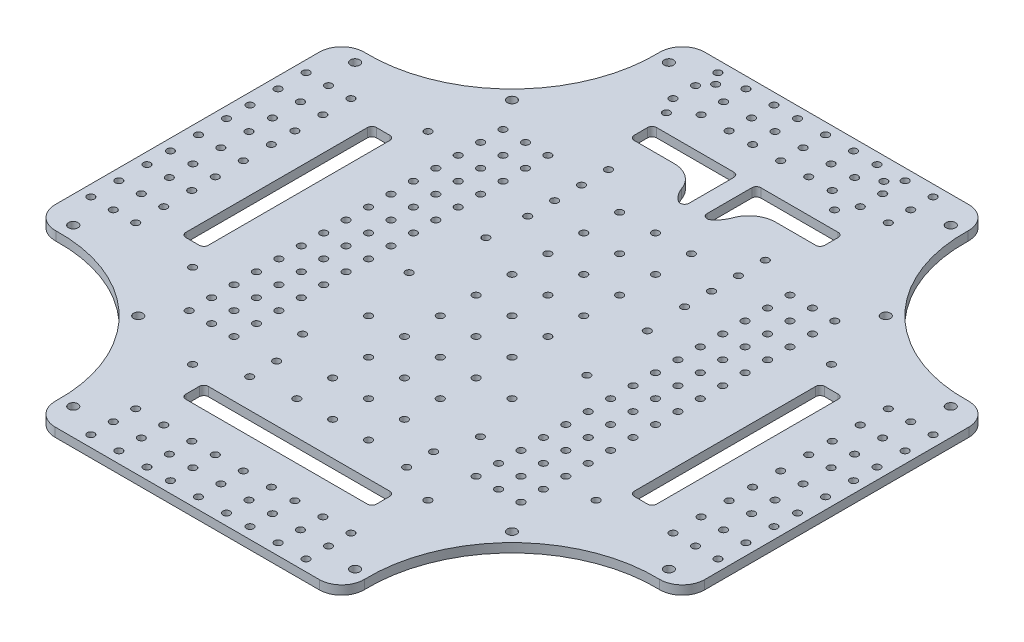
from build123d import *

# Parameters (mm, degrees)
SKETCH_1_R               = 2.075
SKETCH_1_R_2             = 1.6
EXTRUDE_1_DEPTH          = 2
FILLET_1_R               = 10
SKETCH_2_R               = 1.6
CUT_EXTRUDE_1_DEPTH      = 205.909000639
SKETCH_3_R               = 1.6
CUT_EXTRUDE_2_DEPTH      = 205.909000639
SKETCH_4_R               = 1.6
CUT_EXTRUDE_3_DEPTH      = 205.909000639
CUT_EXTRUDE_4_DEPTH      = 205.909000639
FILLET_2_R               = 2
CUT_EXTRUDE_5_DEPTH      = 205.909000639
CUT_EXTRUDE_5_DEPTH_BACK = 205.909000639
SKETCH_7_R               = 1.6


with BuildPart() as part:
    # 草图1 → 凸台-拉伸1 (new, symmetric)
    with BuildSketch(Plane(origin=(0, 0, 0), x_dir=(1, 0, 0), z_dir=(0, 1, 0))):
        with BuildLine():
            ThreePointArc((-68.864934582, 132.864934582), (-92.072778473, 83.549622558), (-144.864934582, 70))
            Line((-144.864934582, 70), (-144.864934582, -70))
            ThreePointArc((-144.864934582, -70), (-92.072778473, -83.549622558), (-68.864934582, -132.864934582))
            ThreePointArc((-68.864934582, -132.864934582), (-69.14933283, -138.891715927), (-70, -144.864934582))
            Line((-70, -144.864934582), (70, -144.864934582))
            ThreePointArc((70, -144.864934582), (87.610100586, -87.610100586), (144.864934582, -70))
            Line((144.864934582, -70), (144.864934582, 70))
            ThreePointArc((144.864934582, 70), (87.610100586, 87.610100586), (70, 144.864934582))
            Line((70, 144.864934582), (-70, 144.864934582))
            ThreePointArc((-70, 144.864934582), (-69.14933283, 138.891715927), (-68.864934582, 132.864934582))
        make_face()
        with Locations((-62.864934582, -132.864934582)):
            Circle(SKETCH_1_R, mode=Mode.SUBTRACT)
        with Locations((-48, -139.864934582)):
            Circle(SKETCH_1_R_2, mode=Mode.SUBTRACT)
        with Locations((-35.5, -139.864934582)):
            Circle(SKETCH_1_R_2, mode=Mode.SUBTRACT)
        with Locations((-48, -129.864934582)):
            Circle(SKETCH_1_R_2, mode=Mode.SUBTRACT)
        with Locations((-35.5, -129.864934582)):
            Circle(SKETCH_1_R_2, mode=Mode.SUBTRACT)
        with Locations((-23, -139.864934582)):
            Circle(SKETCH_1_R_2, mode=Mode.SUBTRACT)
        with Locations((-12.5, -139.864934582)):
            Circle(SKETCH_1_R_2, mode=Mode.SUBTRACT)
        with Locations((-23, -129.864934582)):
            Circle(SKETCH_1_R_2, mode=Mode.SUBTRACT)
        with Locations((-12.5, -129.864934582)):
            Circle(SKETCH_1_R_2, mode=Mode.SUBTRACT)
        with Locations((-48, -119.864934582)):
            Circle(SKETCH_1_R_2, mode=Mode.SUBTRACT)
        with Locations((-35.5, -119.864934582)):
            Circle(SKETCH_1_R_2, mode=Mode.SUBTRACT)
        with Locations((-23, -119.864934582)):
            Circle(SKETCH_1_R_2, mode=Mode.SUBTRACT)
        with Locations((-12.5, -119.864934582)):
            Circle(SKETCH_1_R_2, mode=Mode.SUBTRACT)
        with Locations((-132.864934582, -62.864934582)):
            Circle(SKETCH_1_R, mode=Mode.SUBTRACT)
        with Locations((-139.864934582, -48)):
            Circle(SKETCH_1_R_2, mode=Mode.SUBTRACT)
        with Locations((-129.864934582, -48)):
            Circle(SKETCH_1_R_2, mode=Mode.SUBTRACT)
        with Locations((-139.864934582, -35.5)):
            Circle(SKETCH_1_R_2, mode=Mode.SUBTRACT)
        with Locations((-129.864934582, -35.5)):
            Circle(SKETCH_1_R_2, mode=Mode.SUBTRACT)
        with Locations((-119.864934582, -48)):
            Circle(SKETCH_1_R_2, mode=Mode.SUBTRACT)
        with Locations((-119.864934582, -35.5)):
            Circle(SKETCH_1_R_2, mode=Mode.SUBTRACT)
        with Locations((-139.864934582, -23)):
            Circle(SKETCH_1_R_2, mode=Mode.SUBTRACT)
        with Locations((-139.864934582, -12.5)):
            Circle(SKETCH_1_R_2, mode=Mode.SUBTRACT)
        with Locations((-129.864934582, -23)):
            Circle(SKETCH_1_R_2, mode=Mode.SUBTRACT)
        with Locations((-129.864934582, -12.5)):
            Circle(SKETCH_1_R_2, mode=Mode.SUBTRACT)
        with Locations((-119.864934582, -23)):
            Circle(SKETCH_1_R_2, mode=Mode.SUBTRACT)
        with Locations((-119.864934582, -12.5)):
            Circle(SKETCH_1_R_2, mode=Mode.SUBTRACT)
        with Locations((-83.367459899, -83.367459899)):
            Circle(SKETCH_1_R, mode=Mode.SUBTRACT)
        with Locations((0, -139.864934582)):
            Circle(SKETCH_1_R_2, mode=Mode.SUBTRACT)
        with Locations((12.5, -139.864934582)):
            Circle(SKETCH_1_R_2, mode=Mode.SUBTRACT)
        with Locations((23, -139.864934582)):
            Circle(SKETCH_1_R_2, mode=Mode.SUBTRACT)
        with Locations((0, -129.864934582)):
            Circle(SKETCH_1_R_2, mode=Mode.SUBTRACT)
        with Locations((12.5, -129.864934582)):
            Circle(SKETCH_1_R_2, mode=Mode.SUBTRACT)
        with Locations((23, -129.864934582)):
            Circle(SKETCH_1_R_2, mode=Mode.SUBTRACT)
        with Locations((35.5, -139.864934582)):
            Circle(SKETCH_1_R_2, mode=Mode.SUBTRACT)
        with Locations((48, -139.864934582)):
            Circle(SKETCH_1_R_2, mode=Mode.SUBTRACT)
        with Locations((35.5, -129.864934582)):
            Circle(SKETCH_1_R_2, mode=Mode.SUBTRACT)
        with Locations((48, -129.864934582)):
            Circle(SKETCH_1_R_2, mode=Mode.SUBTRACT)
        with Locations((0, -119.864934582)):
            Circle(SKETCH_1_R_2, mode=Mode.SUBTRACT)
        with Locations((12.5, -119.864934582)):
            Circle(SKETCH_1_R_2, mode=Mode.SUBTRACT)
        with Locations((23, -119.864934582)):
            Circle(SKETCH_1_R_2, mode=Mode.SUBTRACT)
        with Locations((35.5, -119.864934582)):
            Circle(SKETCH_1_R_2, mode=Mode.SUBTRACT)
        with Locations((48, -119.864934582)):
            Circle(SKETCH_1_R_2, mode=Mode.SUBTRACT)
        with Locations((62.864934582, -132.864934582)):
            Circle(SKETCH_1_R, mode=Mode.SUBTRACT)
        with Locations((83.367459899, -83.367459899)):
            Circle(SKETCH_1_R, mode=Mode.SUBTRACT)
        with Locations((132.864934582, -62.864934582)):
            Circle(SKETCH_1_R, mode=Mode.SUBTRACT)
        with Locations((119.864934582, -48)):
            Circle(SKETCH_1_R_2, mode=Mode.SUBTRACT)
        with Locations((119.864934582, -35.5)):
            Circle(SKETCH_1_R_2, mode=Mode.SUBTRACT)
        with Locations((129.864934582, -48)):
            Circle(SKETCH_1_R_2, mode=Mode.SUBTRACT)
        with Locations((139.864934582, -48)):
            Circle(SKETCH_1_R_2, mode=Mode.SUBTRACT)
        with Locations((129.864934582, -35.5)):
            Circle(SKETCH_1_R_2, mode=Mode.SUBTRACT)
        with Locations((139.864934582, -35.5)):
            Circle(SKETCH_1_R_2, mode=Mode.SUBTRACT)
        with Locations((119.864934582, -23)):
            Circle(SKETCH_1_R_2, mode=Mode.SUBTRACT)
        with Locations((119.864934582, -12.5)):
            Circle(SKETCH_1_R_2, mode=Mode.SUBTRACT)
        with Locations((129.864934582, -23)):
            Circle(SKETCH_1_R_2, mode=Mode.SUBTRACT)
        with Locations((129.864934582, -12.5)):
            Circle(SKETCH_1_R_2, mode=Mode.SUBTRACT)
        with Locations((139.864934582, -23)):
            Circle(SKETCH_1_R_2, mode=Mode.SUBTRACT)
        with Locations((139.864934582, -12.5)):
            Circle(SKETCH_1_R_2, mode=Mode.SUBTRACT)
        with Locations((-139.864934582, 0)):
            Circle(SKETCH_1_R_2, mode=Mode.SUBTRACT)
        with Locations((-129.864934582, 0)):
            Circle(SKETCH_1_R_2, mode=Mode.SUBTRACT)
        with Locations((-139.864934582, 12.5)):
            Circle(SKETCH_1_R_2, mode=Mode.SUBTRACT)
        with Locations((-139.864934582, 23)):
            Circle(SKETCH_1_R_2, mode=Mode.SUBTRACT)
        with Locations((-129.864934582, 12.5)):
            Circle(SKETCH_1_R_2, mode=Mode.SUBTRACT)
        with Locations((-129.864934582, 23)):
            Circle(SKETCH_1_R_2, mode=Mode.SUBTRACT)
        with Locations((-119.864934582, 0)):
            Circle(SKETCH_1_R_2, mode=Mode.SUBTRACT)
        with Locations((-119.864934582, 12.5)):
            Circle(SKETCH_1_R_2, mode=Mode.SUBTRACT)
        with Locations((-119.864934582, 23)):
            Circle(SKETCH_1_R_2, mode=Mode.SUBTRACT)
        with Locations((-139.864934582, 35.5)):
            Circle(SKETCH_1_R_2, mode=Mode.SUBTRACT)
        with Locations((-129.864934582, 35.5)):
            Circle(SKETCH_1_R_2, mode=Mode.SUBTRACT)
        with Locations((-139.864934582, 48)):
            Circle(SKETCH_1_R_2, mode=Mode.SUBTRACT)
        with Locations((-129.864934582, 48)):
            Circle(SKETCH_1_R_2, mode=Mode.SUBTRACT)
        with Locations((-119.864934582, 35.5)):
            Circle(SKETCH_1_R_2, mode=Mode.SUBTRACT)
        with Locations((-119.864934582, 48)):
            Circle(SKETCH_1_R_2, mode=Mode.SUBTRACT)
        with Locations((-132.864934582, 62.864934582)):
            Circle(SKETCH_1_R, mode=Mode.SUBTRACT)
        with Locations((-83.367459899, 83.367459899)):
            Circle(SKETCH_1_R, mode=Mode.SUBTRACT)
        with Locations((-62.864934582, 132.864934582)):
            Circle(SKETCH_1_R, mode=Mode.SUBTRACT)
        with Locations((-48, 119.864934582)):
            Circle(SKETCH_1_R_2, mode=Mode.SUBTRACT)
        with Locations((-35.5, 119.864934582)):
            Circle(SKETCH_1_R_2, mode=Mode.SUBTRACT)
        with Locations((-23, 119.864934582)):
            Circle(SKETCH_1_R_2, mode=Mode.SUBTRACT)
        with Locations((-12.5, 119.864934582)):
            Circle(SKETCH_1_R_2, mode=Mode.SUBTRACT)
        with Locations((-48, 129.864934582)):
            Circle(SKETCH_1_R_2, mode=Mode.SUBTRACT)
        with Locations((-35.5, 129.864934582)):
            Circle(SKETCH_1_R_2, mode=Mode.SUBTRACT)
        with Locations((-48, 139.864934582)):
            Circle(SKETCH_1_R_2, mode=Mode.SUBTRACT)
        with Locations((-35.5, 139.864934582)):
            Circle(SKETCH_1_R_2, mode=Mode.SUBTRACT)
        with Locations((-23, 129.864934582)):
            Circle(SKETCH_1_R_2, mode=Mode.SUBTRACT)
        with Locations((-12.5, 129.864934582)):
            Circle(SKETCH_1_R_2, mode=Mode.SUBTRACT)
        with Locations((-23, 139.864934582)):
            Circle(SKETCH_1_R_2, mode=Mode.SUBTRACT)
        with Locations((-12.5, 139.864934582)):
            Circle(SKETCH_1_R_2, mode=Mode.SUBTRACT)
        with Locations((83.367459899, 83.367459899)):
            Circle(SKETCH_1_R, mode=Mode.SUBTRACT)
        with Locations((119.864934582, 0)):
            Circle(SKETCH_1_R_2, mode=Mode.SUBTRACT)
        with Locations((119.864934582, 12.5)):
            Circle(SKETCH_1_R_2, mode=Mode.SUBTRACT)
        with Locations((119.864934582, 23)):
            Circle(SKETCH_1_R_2, mode=Mode.SUBTRACT)
        with Locations((129.864934582, 0)):
            Circle(SKETCH_1_R_2, mode=Mode.SUBTRACT)
        with Locations((139.864934582, 0)):
            Circle(SKETCH_1_R_2, mode=Mode.SUBTRACT)
        with Locations((129.864934582, 12.5)):
            Circle(SKETCH_1_R_2, mode=Mode.SUBTRACT)
        with Locations((129.864934582, 23)):
            Circle(SKETCH_1_R_2, mode=Mode.SUBTRACT)
        with Locations((139.864934582, 12.5)):
            Circle(SKETCH_1_R_2, mode=Mode.SUBTRACT)
        with Locations((139.864934582, 23)):
            Circle(SKETCH_1_R_2, mode=Mode.SUBTRACT)
        with Locations((119.864934582, 35.5)):
            Circle(SKETCH_1_R_2, mode=Mode.SUBTRACT)
        with Locations((119.864934582, 48)):
            Circle(SKETCH_1_R_2, mode=Mode.SUBTRACT)
        with Locations((129.864934582, 35.5)):
            Circle(SKETCH_1_R_2, mode=Mode.SUBTRACT)
        with Locations((139.864934582, 35.5)):
            Circle(SKETCH_1_R_2, mode=Mode.SUBTRACT)
        with Locations((129.864934582, 48)):
            Circle(SKETCH_1_R_2, mode=Mode.SUBTRACT)
        with Locations((139.864934582, 48)):
            Circle(SKETCH_1_R_2, mode=Mode.SUBTRACT)
        with Locations((132.864934582, 62.864934582)):
            Circle(SKETCH_1_R, mode=Mode.SUBTRACT)
        with Locations((0, 119.864934582)):
            Circle(SKETCH_1_R_2, mode=Mode.SUBTRACT)
        with Locations((12.5, 119.864934582)):
            Circle(SKETCH_1_R_2, mode=Mode.SUBTRACT)
        with Locations((23, 119.864934582)):
            Circle(SKETCH_1_R_2, mode=Mode.SUBTRACT)
        with Locations((35.5, 119.864934582)):
            Circle(SKETCH_1_R_2, mode=Mode.SUBTRACT)
        with Locations((48, 119.864934582)):
            Circle(SKETCH_1_R_2, mode=Mode.SUBTRACT)
        with Locations((0, 129.864934582)):
            Circle(SKETCH_1_R_2, mode=Mode.SUBTRACT)
        with Locations((12.5, 129.864934582)):
            Circle(SKETCH_1_R_2, mode=Mode.SUBTRACT)
        with Locations((23, 129.864934582)):
            Circle(SKETCH_1_R_2, mode=Mode.SUBTRACT)
        with Locations((0, 139.864934582)):
            Circle(SKETCH_1_R_2, mode=Mode.SUBTRACT)
        with Locations((12.5, 139.864934582)):
            Circle(SKETCH_1_R_2, mode=Mode.SUBTRACT)
        with Locations((23, 139.864934582)):
            Circle(SKETCH_1_R_2, mode=Mode.SUBTRACT)
        with Locations((35.5, 129.864934582)):
            Circle(SKETCH_1_R_2, mode=Mode.SUBTRACT)
        with Locations((48, 129.864934582)):
            Circle(SKETCH_1_R_2, mode=Mode.SUBTRACT)
        with Locations((35.5, 139.864934582)):
            Circle(SKETCH_1_R_2, mode=Mode.SUBTRACT)
        with Locations((48, 139.864934582)):
            Circle(SKETCH_1_R_2, mode=Mode.SUBTRACT)
        with Locations((62.864934582, 132.864934582)):
            Circle(SKETCH_1_R, mode=Mode.SUBTRACT)
    extrude(amount=EXTRUDE_1_DEPTH, both=True)

    # 圆角1
    fillet_1_edges = [part.edges().sort_by_distance(p)[0] for p in [
        (-144.864934582, 0, -70),
        (-70, 0, -144.864934582),
        (70, 0, -144.864934582),
        (144.864934582, 0, -70),
        (144.864934582, 0, 70),
        (70, 0, 144.864934582),
        (-144.864934582, 0, 70),
        (-70, 0, 144.864934582),
    ]]
    fillet(fillet_1_edges, radius=FILLET_1_R)

    # 草图2 → 切除-拉伸1 (cut, through all)
    with BuildSketch(Plane(origin=(0, 2, 0), x_dir=(1, 0, 0), z_dir=(0, 1, 0))):
        with Locations((-52.5, -90)):
            Circle(SKETCH_2_R)
        with Locations((52.5, -90)):
            Circle(SKETCH_2_R)
        with Locations((-90, 52.5)):
            Circle(SKETCH_2_R)
        with Locations((-90, -52.5)):
            Circle(SKETCH_2_R)
        with Locations((90, -52.5)):
            Circle(SKETCH_2_R)
        with Locations((90, 52.5)):
            Circle(SKETCH_2_R)
    extrude(amount=-CUT_EXTRUDE_1_DEPTH, mode=Mode.SUBTRACT)

    # 草图3 → 切除-拉伸2 (cut, through all)
    with BuildSketch(Plane(origin=(0, 2, 0), x_dir=(1, 0, 0), z_dir=(0, 1, 0))):
        with Locations((-44, 134.864934582)):
            Circle(SKETCH_3_R)
        with Locations((-44, 112.864934582)):
            Circle(SKETCH_3_R)
        with Locations((31, 134.864934582)):
            Circle(SKETCH_3_R)
        with Locations((31, 112.864934582)):
            Circle(SKETCH_3_R)
    extrude(amount=-CUT_EXTRUDE_2_DEPTH, mode=Mode.SUBTRACT)

    # 草图4 → 切除-拉伸3 (cut, through all)
    with BuildSketch(Plane(origin=(0, 2, 0), x_dir=(1, 0, 0), z_dir=(0, 1, 0))):
        with Locations((-39.6345, -6.251)):
            Circle(SKETCH_4_R)
        with Locations((-39.6345, -53.749)):
            Circle(SKETCH_4_R)
        with Locations((39.6345, -6.251)):
            Circle(SKETCH_4_R)
        with Locations((39.6345, -53.749)):
            Circle(SKETCH_4_R)
        with Locations((-36, 24.353829072)):
            Circle(SKETCH_4_R)
        with Locations((36, 24.353829072)):
            Circle(SKETCH_4_R)
    extrude(amount=-CUT_EXTRUDE_3_DEPTH, mode=Mode.SUBTRACT)

    # 草图6 → 切除-拉伸4 (cut, through all)
    with BuildSketch(Plane(origin=(0, 2, 0), x_dir=(1, 0, 0), z_dir=(0, 1, 0))):
        with BuildLine():
            Line((105, -40.5), (105, 40.5))
            ThreePointArc((105, 40.5), (104.414213562, 41.914213562), (103, 42.5))
            Line((103, 42.5), (97, 42.5))
            ThreePointArc((97, 42.5), (95.585786438, 41.914213562), (95, 40.5))
            Line((95, 40.5), (95, -40.5))
            ThreePointArc((95, -40.5), (95.585786438, -41.914213562), (97, -42.5))
            Line((97, -42.5), (103, -42.5))
            ThreePointArc((103, -42.5), (104.414213562, -41.914213562), (105, -40.5))
        make_face()
        with BuildLine():
            Line((-4, 105), (-40.5, 105))
            ThreePointArc((-40.5, 105), (-41.914213562, 104.414213562), (-42.5, 103))
            Line((-42.5, 103), (-42.5, 97))
            ThreePointArc((-42.5, 97), (-41.914213562, 95.585786438), (-40.5, 95))
            Line((-40.5, 95), (-22.627416998, 95))
            ThreePointArc((-22.627416998, 95), (-15.699213768, 92.797958971), (-11.313708499, 87))
            ThreePointArc((-11.313708499, 87), (-8.485281374, 82.514718626), (-4, 79.686291501))
            Line((-4, 79.686291501), (-4, 105))
        make_face()
        with BuildLine():
            Line((40.5, 105), (4, 105))
            Line((4, 105), (4, 79.686291501))
            ThreePointArc((4, 79.686291501), (8.485281374, 82.514718626), (11.313708499, 87))
            ThreePointArc((11.313708499, 87), (15.699213768, 92.797958971), (22.627416998, 95))
            Line((22.627416998, 95), (40.5, 95))
            ThreePointArc((40.5, 95), (41.914213562, 95.585786438), (42.5, 97))
            Line((42.5, 97), (42.5, 103))
            ThreePointArc((42.5, 103), (41.914213562, 104.414213562), (40.5, 105))
        make_face()
        with BuildLine():
            Line((-40.5, -105), (40.5, -105))
            ThreePointArc((40.5, -105), (41.914213562, -104.414213562), (42.5, -103))
            Line((42.5, -103), (42.5, -97))
            ThreePointArc((42.5, -97), (41.914213562, -95.585786438), (40.5, -95))
            Line((40.5, -95), (-40.5, -95))
            ThreePointArc((-40.5, -95), (-41.914213562, -95.585786438), (-42.5, -97))
            Line((-42.5, -97), (-42.5, -103))
            ThreePointArc((-42.5, -103), (-41.914213562, -104.414213562), (-40.5, -105))
        make_face()
        with BuildLine():
            Line((-105, 40.5), (-105, -40.5))
            ThreePointArc((-105, -40.5), (-104.414213562, -41.914213562), (-103, -42.5))
            Line((-103, -42.5), (-97, -42.5))
            ThreePointArc((-97, -42.5), (-95.585786438, -41.914213562), (-95, -40.5))
            Line((-95, -40.5), (-95, 40.5))
            ThreePointArc((-95, 40.5), (-95.585786438, 41.914213562), (-97, 42.5))
            Line((-97, 42.5), (-103, 42.5))
            ThreePointArc((-103, 42.5), (-104.414213562, 41.914213562), (-105, 40.5))
        make_face()
    extrude(amount=-CUT_EXTRUDE_4_DEPTH, mode=Mode.SUBTRACT)

    # 圆角2
    fillet_2_edges = [part.edges().sort_by_distance(p)[0] for p in [
        (4, 0, -79.686291501),
        (-4, 0, -79.686291501),
        (4, 0, -105),
        (-4, 0, -105),
    ]]
    fillet(fillet_2_edges, radius=FILLET_2_R)

    # 草图7 → 切除-拉伸5 (cut, two sides: drawn at the far end of the back side and taken through both)
    with BuildSketch(Plane.XZ.offset(2).offset(-CUT_EXTRUDE_5_DEPTH_BACK)):
        with Locations((-16, 0)):
            Circle(SKETCH_7_R)
        with Locations((0, 16)):
            Circle(SKETCH_7_R)
        with Locations((16, 0)):
            Circle(SKETCH_7_R)
        with Locations((0, -16)):
            Circle(SKETCH_7_R)
        with Locations((0, 32)):
            Circle(SKETCH_7_R)
        with Locations((0, 48)):
            Circle(SKETCH_7_R)
        with Locations((0, 64)):
            Circle(SKETCH_7_R)
        with Locations((0, 80)):
            Circle(SKETCH_7_R)
        Circle(SKETCH_7_R)
        with Locations((0, -64)):
            Circle(SKETCH_7_R)
        with Locations((0, -48)):
            Circle(SKETCH_7_R)
        with Locations((0, -32)):
            Circle(SKETCH_7_R)
        with Locations((16, 16)):
            Circle(SKETCH_7_R)
        with Locations((16, 32)):
            Circle(SKETCH_7_R)
        with Locations((16, 48)):
            Circle(SKETCH_7_R)
        with Locations((16, 64)):
            Circle(SKETCH_7_R)
        with Locations((16, 80)):
            Circle(SKETCH_7_R)
        with Locations((16, -16)):
            Circle(SKETCH_7_R)
        with Locations((16, -64)):
            Circle(SKETCH_7_R)
        with Locations((16, -48)):
            Circle(SKETCH_7_R)
        with Locations((16, -32)):
            Circle(SKETCH_7_R)
        with Locations((-16, 16)):
            Circle(SKETCH_7_R)
        with Locations((-16, 32)):
            Circle(SKETCH_7_R)
        with Locations((-16, 48)):
            Circle(SKETCH_7_R)
        with Locations((-16, 64)):
            Circle(SKETCH_7_R)
        with Locations((-16, 80)):
            Circle(SKETCH_7_R)
        with Locations((-16, -16)):
            Circle(SKETCH_7_R)
        with Locations((-16, -64)):
            Circle(SKETCH_7_R)
        with Locations((-16, -48)):
            Circle(SKETCH_7_R)
        with Locations((-16, -32)):
            Circle(SKETCH_7_R)
        with Locations((-64, 0)):
            Circle(SKETCH_7_R)
        with Locations((-54, 0)):
            Circle(SKETCH_7_R)
        with Locations((-74, 0)):
            Circle(SKETCH_7_R)
        with Locations((-64, -10)):
            Circle(SKETCH_7_R)
        with Locations((-54, -10)):
            Circle(SKETCH_7_R)
        with Locations((-74, -10)):
            Circle(SKETCH_7_R)
        with Locations((-64, -20)):
            Circle(SKETCH_7_R)
        with Locations((-54, -20)):
            Circle(SKETCH_7_R)
        with Locations((-74, -20)):
            Circle(SKETCH_7_R)
        with Locations((-64, -30)):
            Circle(SKETCH_7_R)
        with Locations((-54, -30)):
            Circle(SKETCH_7_R)
        with Locations((-74, -30)):
            Circle(SKETCH_7_R)
        with Locations((-64, -40)):
            Circle(SKETCH_7_R)
        with Locations((-54, -40)):
            Circle(SKETCH_7_R)
        with Locations((-74, -40)):
            Circle(SKETCH_7_R)
        with Locations((-64, -50)):
            Circle(SKETCH_7_R)
        with Locations((-54, -50)):
            Circle(SKETCH_7_R)
        with Locations((-74, -50)):
            Circle(SKETCH_7_R)
        with Locations((-64, -60)):
            Circle(SKETCH_7_R)
        with Locations((-54, -60)):
            Circle(SKETCH_7_R)
        with Locations((-74, -60)):
            Circle(SKETCH_7_R)
        with Locations((-64, -70)):
            Circle(SKETCH_7_R)
        with Locations((-54, -70)):
            Circle(SKETCH_7_R)
        with Locations((-74, -70)):
            Circle(SKETCH_7_R)
        with Locations((-74, 70)):
            Circle(SKETCH_7_R)
        with Locations((-54, 70)):
            Circle(SKETCH_7_R)
        with Locations((-64, 70)):
            Circle(SKETCH_7_R)
        with Locations((-74, 60)):
            Circle(SKETCH_7_R)
        with Locations((-54, 60)):
            Circle(SKETCH_7_R)
        with Locations((-64, 60)):
            Circle(SKETCH_7_R)
        with Locations((-74, 50)):
            Circle(SKETCH_7_R)
        with Locations((-54, 50)):
            Circle(SKETCH_7_R)
        with Locations((-64, 50)):
            Circle(SKETCH_7_R)
        with Locations((-74, 40)):
            Circle(SKETCH_7_R)
        with Locations((-54, 40)):
            Circle(SKETCH_7_R)
        with Locations((-64, 40)):
            Circle(SKETCH_7_R)
        with Locations((-74, 30)):
            Circle(SKETCH_7_R)
        with Locations((-54, 30)):
            Circle(SKETCH_7_R)
        with Locations((-64, 30)):
            Circle(SKETCH_7_R)
        with Locations((-74, 20)):
            Circle(SKETCH_7_R)
        with Locations((-54, 20)):
            Circle(SKETCH_7_R)
        with Locations((-64, 20)):
            Circle(SKETCH_7_R)
        with Locations((-74, 10)):
            Circle(SKETCH_7_R)
        with Locations((-54, 10)):
            Circle(SKETCH_7_R)
        with Locations((-64, 10)):
            Circle(SKETCH_7_R)
        with Locations((64, 10)):
            Circle(SKETCH_7_R)
        with Locations((54, 10)):
            Circle(SKETCH_7_R)
        with Locations((74, 10)):
            Circle(SKETCH_7_R)
        with Locations((64, 20)):
            Circle(SKETCH_7_R)
        with Locations((54, 20)):
            Circle(SKETCH_7_R)
        with Locations((74, 20)):
            Circle(SKETCH_7_R)
        with Locations((64, 30)):
            Circle(SKETCH_7_R)
        with Locations((54, 30)):
            Circle(SKETCH_7_R)
        with Locations((74, 30)):
            Circle(SKETCH_7_R)
        with Locations((64, 40)):
            Circle(SKETCH_7_R)
        with Locations((54, 40)):
            Circle(SKETCH_7_R)
        with Locations((74, 40)):
            Circle(SKETCH_7_R)
        with Locations((64, 50)):
            Circle(SKETCH_7_R)
        with Locations((54, 50)):
            Circle(SKETCH_7_R)
        with Locations((74, 50)):
            Circle(SKETCH_7_R)
        with Locations((64, 60)):
            Circle(SKETCH_7_R)
        with Locations((54, 60)):
            Circle(SKETCH_7_R)
        with Locations((74, 60)):
            Circle(SKETCH_7_R)
        with Locations((64, 70)):
            Circle(SKETCH_7_R)
        with Locations((54, 70)):
            Circle(SKETCH_7_R)
        with Locations((74, 70)):
            Circle(SKETCH_7_R)
        with Locations((74, -70)):
            Circle(SKETCH_7_R)
        with Locations((54, -70)):
            Circle(SKETCH_7_R)
        with Locations((64, -70)):
            Circle(SKETCH_7_R)
        with Locations((74, -60)):
            Circle(SKETCH_7_R)
        with Locations((54, -60)):
            Circle(SKETCH_7_R)
        with Locations((64, -60)):
            Circle(SKETCH_7_R)
        with Locations((74, -50)):
            Circle(SKETCH_7_R)
        with Locations((54, -50)):
            Circle(SKETCH_7_R)
        with Locations((64, -50)):
            Circle(SKETCH_7_R)
        with Locations((74, -40)):
            Circle(SKETCH_7_R)
        with Locations((54, -40)):
            Circle(SKETCH_7_R)
        with Locations((64, -40)):
            Circle(SKETCH_7_R)
        with Locations((74, -30)):
            Circle(SKETCH_7_R)
        with Locations((54, -30)):
            Circle(SKETCH_7_R)
        with Locations((64, -30)):
            Circle(SKETCH_7_R)
        with Locations((74, -20)):
            Circle(SKETCH_7_R)
        with Locations((54, -20)):
            Circle(SKETCH_7_R)
        with Locations((64, -20)):
            Circle(SKETCH_7_R)
        with Locations((74, -10)):
            Circle(SKETCH_7_R)
        with Locations((54, -10)):
            Circle(SKETCH_7_R)
        with Locations((64, -10)):
            Circle(SKETCH_7_R)
        with Locations((74, 0)):
            Circle(SKETCH_7_R)
        with Locations((54, 0)):
            Circle(SKETCH_7_R)
        with Locations((64, 0)):
            Circle(SKETCH_7_R)
        with Locations((-35, 82)):
            Circle(SKETCH_7_R)
        with Locations((-35, 70)):
            Circle(SKETCH_7_R)
        with Locations((35, 70)):
            Circle(SKETCH_7_R)
        with Locations((35, 82)):
            Circle(SKETCH_7_R)
        with Locations((-35, -42)):
            Circle(SKETCH_7_R)
        with Locations((-35, -54)):
            Circle(SKETCH_7_R)
        with Locations((-35, -66)):
            Circle(SKETCH_7_R)
        with Locations((-35, -78)):
            Circle(SKETCH_7_R)
        with Locations((35, -78)):
            Circle(SKETCH_7_R)
        with Locations((35, -66)):
            Circle(SKETCH_7_R)
        with Locations((35, -54)):
            Circle(SKETCH_7_R)
        with Locations((35, -42)):
            Circle(SKETCH_7_R)
        with Locations((32, 32)):
            Circle(SKETCH_7_R)
        with Locations((-32, 32)):
            Circle(SKETCH_7_R)
    extrude(amount=CUT_EXTRUDE_5_DEPTH + CUT_EXTRUDE_5_DEPTH_BACK, mode=Mode.SUBTRACT)


solid = part.part
